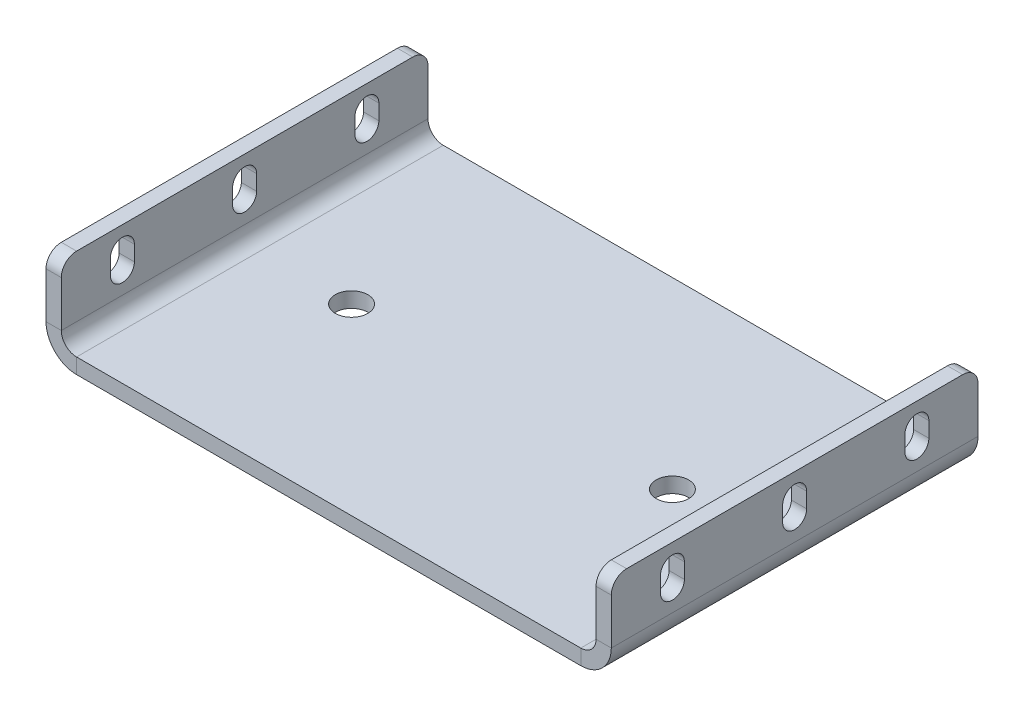
from build123d import *

# Parameters (mm, degrees)
BASE_FLANGE1_DEPTH = 76.2
CUT_EXTRUDE1_DEPTH = 142.314253085
SKETCH7_R          = 3.3782
CUT_EXTRUDE2_DEPTH = 142.314253085
FILLET1_R          = 3.175


# Sheet-metal steps are written as plain solids
with BuildPart() as part:
    # Sketch1 → Base-Flange1 (new body)
    with BuildSketch(Plane.XY):
        with BuildLine():
            Line((117.475, 19.05), (117.475, 6.35))
            ThreePointArc((117.475, 6.35), (115.615128061, 1.859871939), (111.125, 0))
            Line((111.125, 0), (6.35, 0))
            ThreePointArc((6.35, 0), (1.859871939, 1.859871939), (0, 6.35))
            Line((0, 6.35), (0, 19.05))
            Line((0, 19.05), (3.175, 19.05))
            Line((3.175, 19.05), (3.175, 6.35))
            ThreePointArc((3.175, 6.35), (4.10493597, 4.10493597), (6.35, 3.175))
            Line((6.35, 3.175), (111.125, 3.175))
            ThreePointArc((111.125, 3.175), (113.37006403, 4.10493597), (114.3, 6.35))
            Line((114.3, 6.35), (114.3, 19.05))
            Line((114.3, 19.05), (117.475, 19.05))
        make_face()
    extrude(amount=BASE_FLANGE1_DEPTH)

    # Sketch6 → Cut-Extrude1 (cut, through all)
    with BuildSketch(Plane.ZY):
        with BuildLine():
            Line((35.6108, 11.1125), (35.6108, 14.2875))
            ThreePointArc((35.6108, 14.2875), (38.1, 16.7767), (40.5892, 14.2875))
            Line((40.5892, 14.2875), (40.5892, 11.1125))
            ThreePointArc((40.5892, 11.1125), (38.1, 8.6233), (35.6108, 11.1125))
        make_face()
        with BuildLine():
            Line((10.2108, 11.1125), (10.2108, 14.2875))
            ThreePointArc((10.2108, 14.2875), (12.7, 16.7767), (15.1892, 14.2875))
            Line((15.1892, 14.2875), (15.1892, 11.1125))
            ThreePointArc((15.1892, 11.1125), (12.7, 8.6233), (10.2108, 11.1125))
        make_face()
        with BuildLine():
            Line((61.0108, 11.1125), (61.0108, 14.2875))
            ThreePointArc((61.0108, 14.2875), (63.5, 16.7767), (65.9892, 14.2875))
            Line((65.9892, 14.2875), (65.9892, 11.1125))
            ThreePointArc((65.9892, 11.1125), (63.5, 8.6233), (61.0108, 11.1125))
        make_face()
    extrude(amount=-CUT_EXTRUDE1_DEPTH, mode=Mode.SUBTRACT)

    # Sketch7 → Cut-Extrude2 (cut, through all)
    with BuildSketch(Plane.XZ):
        with Locations(Location((92.075, 38.1, 0), (0, 0, 270))):
            Circle(SKETCH7_R)
        with Locations(Location((25.4, 38.1, 0), (0, 0, 270))):
            Circle(SKETCH7_R)
    extrude(amount=-CUT_EXTRUDE2_DEPTH, mode=Mode.SUBTRACT)

    # Fillet1
    fillet1_edges = [part.edges().sort_by_distance(p)[0] for p in [
        (1.5875, 19.05, 0),
        (115.8875, 19.05, 0),
        (1.5875, 19.05, 76.2),
        (115.8875, 19.05, 76.2),
    ]]
    fillet(fillet1_edges, radius=FILLET1_R)


solid = part.part
